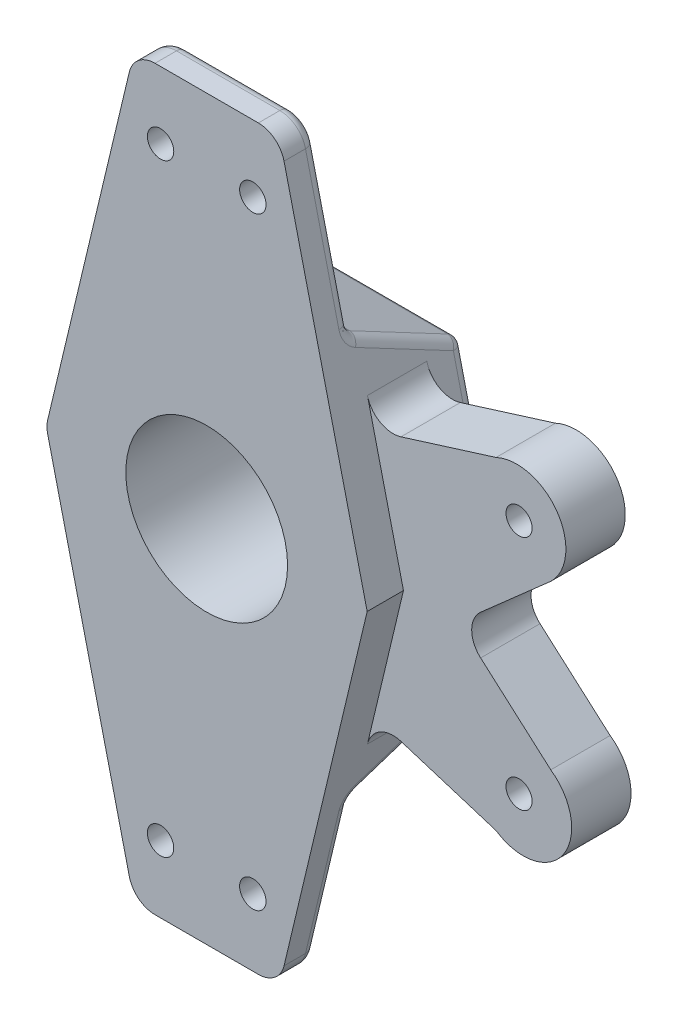
from build123d import *

# Parameters (mm, degrees)
SKETCH1_R               = 30.65
SKETCH1_R_2             = 5.000000000000019
SKETCH1_R_3             = 4.999999999999998
BOSS_EXTRUDE1_DEPTH     = 25
FILLET2_R               = 10
CUT_EXTRUDE1_DEPTH      = 155.39619402857505
CUT_EXTRUDE1_DEPTH_BACK = 155.39619402857505
FILLET3_R               = 4
SKETCH4_R               = 4.949999999999991
BOSS_EXTRUDE3_DEPTH     = 11.25
FILLET4_R               = 10


with BuildPart() as part:
    # Sketch1 → Boss-Extrude1 (new, symmetric)
    with BuildSketch(Plane.XY):
        Polygon((-27.47292351344893, 139.70000000000002), (27.47292351344893, 139.70000000000002), (60.803739445114566, 0), (27.47292351344893, -139.70000000000002), (-27.47292351344893, -139.70000000000002), (-60.803739445114566, 0), align=None)
        Circle(SKETCH1_R, mode=Mode.SUBTRACT)
        with Locations((-17.477412519637493, 114.30000000000001)):
            Circle(SKETCH1_R_2, mode=Mode.SUBTRACT)
        with Locations((17.477412519637493, 114.30000000000001)):
            Circle(SKETCH1_R_3, mode=Mode.SUBTRACT)
        with Locations(Location((17.477412519637493, -114.30000000000001, 0), (0, 0, 180))):
            Circle(SKETCH1_R_3, mode=Mode.SUBTRACT)
        with Locations(Location((-17.477412519637493, -114.30000000000001, 0), (0, 0, 180))):
            Circle(SKETCH1_R_2, mode=Mode.SUBTRACT)
    extrude(amount=BOSS_EXTRUDE1_DEPTH, both=True)

    # Fillet2
    fillet2_edges = [part.edges().sort_by_distance(p)[0] for p in [
        (-27.47292351344893, 139.70000000000002, 0),
        (27.47292351344893, 139.70000000000002, 0),
        (27.47292351344893, -139.70000000000002, 0),
        (-27.47292351344893, -139.70000000000002, 0),
        (-60.803739445114566, 0, 0),
    ]]
    fillet(fillet2_edges, radius=FILLET2_R)

    # Sketch3 → Cut-Extrude1 (cut, two sides: drawn at the far end of the back side and taken through both)
    with BuildSketch(Plane(origin=(0, 0, 0), x_dir=(0, 0, -1), z_dir=(1, 0, 0)).offset(-CUT_EXTRUDE1_DEPTH_BACK)):
        Polygon((-12.865509060855137, 139.70000000000005), (-12.86550906085512, 75.50000000000001), (25.000000000000004, 57.50000000000001), (24.999999999999982, 139.70000000000002), align=None)
        Polygon((25.000000000000014, -139.70000000000002), (25.000000000000018, -57.50000000000001), (-12.865509060855102, -75.50000000000001), (-12.865509060855103, -139.70000000000005), align=None)
    extrude(amount=CUT_EXTRUDE1_DEPTH + CUT_EXTRUDE1_DEPTH_BACK, mode=Mode.SUBTRACT)

    # Fillet3
    fillet3_edges = [part.edges().sort_by_distance(p)[0] for p in [
        (-53.667467917209294, -29.910372866127048, -25),
        (-60.5230561954033, 8.021e-14, -25),
        (-25.774597932945706, 137.54880428226312, 12.865509060855132),
        (53.944319559392405, 28.74999999999997, -25),
        (-25.77459793294572, -137.5488042822631, 12.865509060855103),
        (44.93760301379199, 66.5, -6.067245469572445),
        (53.9443195593924, -28.750000000000014, -25),
        (44.93760301379199, -66.50000000000001, -6.067245469572455),
        (-53.667467917209265, 29.91037286612716, -25),
        (-44.937603013791986, 66.50000000000001, -6.067245469572445),
        (0, 57.50000000000001, -25.000000000000004),
        (0, 139.70000000000005, 12.865509060855137),
        (0, 75.50000000000001, 12.86550906085512),
        (36.04770588031947, 103.76037286612711, 12.865509060855128),
        (-36.047705880319455, 103.76037286612714, 12.86550906085513),
        (25.774597932945724, 137.5488042822631, 12.865509060855134),
        (-44.93760301379199, -66.50000000000001, -6.06724546957245),
        (0, -75.50000000000001, 12.865509060855102),
        (36.047705880319455, -103.76037286612714, 12.865509060855105),
        (-36.04770588031947, -103.76037286612711, 12.865509060855103),
        (0, -139.70000000000005, 12.865509060855103),
        (25.77459793294571, -137.54880428226312, 12.865509060855103),
        (-2.842e-14, -57.50000000000001, -25.000000000000018),
    ]]
    fillet(fillet3_edges, radius=FILLET3_R)

    # Sketch4 → Boss-Extrude3 (add, symmetric)
    with BuildSketch(Plane.XY):
        with BuildLine():
            Line((39.24, 43.52257001003122), (95.87, 61.207791492767626))
            ThreePointArc((95.87, 61.207791492767626), (119.08767912067422, 54.86998711849452), (116.61676738541071, 30.93))
            Line((116.61676738541071, 30.93), (81.53, 0))
            Line((81.53, 0), (116.61676738541071, -30.93))
            ThreePointArc((116.61676738541071, -30.93), (121.31902843356795, -56.398938962992844), (95.87, -61.207791492767626))
            Line((95.87, -61.207791492767626), (39.24, -43.52257001003122))
            Line((39.24, -43.52257001003122), (39.24, 43.52257001003122))
        make_face()
        with Locations(Location((104.6, 44.8, 0), (0, 0, 180))):
            Circle(SKETCH4_R, mode=Mode.SUBTRACT)
        with Locations(Location((104.6, -44.8, 0), (0, 0, 180))):
            Circle(SKETCH4_R, mode=Mode.SUBTRACT)
    extrude(amount=BOSS_EXTRUDE3_DEPTH, both=True)

    # Fillet4
    # the kernel refuses this fillet: 10 mm, written as the material it adds along each edge
    with BuildSketch(Plane(origin=(49.64451546283183, 46.77184001498859, -11.25), x_dir=(-0.23207457322542246, 0.972697996534504, 0), z_dir=(0, 0, 1))) as fillet4_piece_1:
        with BuildLine():
            CenterArc((FILLET4_R * 1.07094457583, -FILLET4_R), FILLET4_R, 90, 93.9240410867991)
            Line((FILLET4_R * 0.0732889237732, -FILLET4_R * 1.06843390912), (0, 0))
            Line((0, 0), (FILLET4_R * 1.07094457583, 0))
        make_face()
    extrude(amount=22.5)
    with BuildSketch(Plane(origin=(49.644515462831826, -46.7718400149886, 11.25), x_dir=(-0.23207457322542127, -0.9726979965345043, 0), z_dir=(0, 0, -1))) as fillet4_piece_2:
        with BuildLine():
            CenterArc((FILLET4_R * 1.07094457583, -FILLET4_R), FILLET4_R, 90.00000000000007, 93.9240410867991)
            Line((FILLET4_R * 0.0732889237732, -FILLET4_R * 1.06843390912), (0, 0))
            Line((0, 0), (FILLET4_R * 1.07094457583, 7e-17))
        make_face()
    extrude(amount=22.5)
    with BuildSketch(Plane(origin=(81.53, 0, -11.25), x_dir=(0.7501444387688134, -0.6612740135406971, 0), z_dir=(0, 0, 1))) as fillet4_piece_3:
        with BuildLine():
            CenterArc((FILLET4_R * 1.13439273797, FILLET4_R), FILLET4_R, 172.79421765853166, 97.2057823414683)
            Line((FILLET4_R * 0.14229069045, FILLET4_R * 1.12543335803), (0, 0))
            Line((0, 0), (FILLET4_R * 1.13439273797, -9.9e-16))
        make_face()
    extrude(amount=22.5)
    # the kernel refuses this fillet: 10 mm, written as the material it takes off along each edge
    with BuildSketch(Plane(origin=(50.523056195403285, -1.332e-14, -25), x_dir=(0.9726979965345042, 0.2320745732254223, 0), z_dir=(-0.2320745732254223, 0.9726979965345042, 0))) as fillet4_2_piece_1:
        with BuildLine():
            CenterArc((6, -4), 4, 0, 90)
            Line((10, -4), (10, 0))
            Line((10, 0), (6, 0))
        make_face()
    revolve(axis=Axis((50.523056195403285, -1.332e-14, -25), (0, 0, -1)), revolution_arc=26.838482751093654, mode=Mode.SUBTRACT)
    with BuildSketch(Plane(origin=(60.803739445114566, 0, -11.25), x_dir=(-0.23207457322542363, 0.9726979965345036, 0), z_dir=(0, 0, -1))) as fillet4_2_piece_2:
        with BuildLine():
            CenterArc((FILLET4_R * 0.238588517764, -FILLET4_R), FILLET4_R, 90.00000000000007, 26.838482751093608)
            Line((-FILLET4_R * 0.212888427082, -FILLET4_R * 0.107717215076), (0, 0))
            Line((0, 0), (FILLET4_R * 0.238588517764, 4e-17))
        make_face()
    extrude(amount=13.75, mode=Mode.SUBTRACT)


solid = part.part
